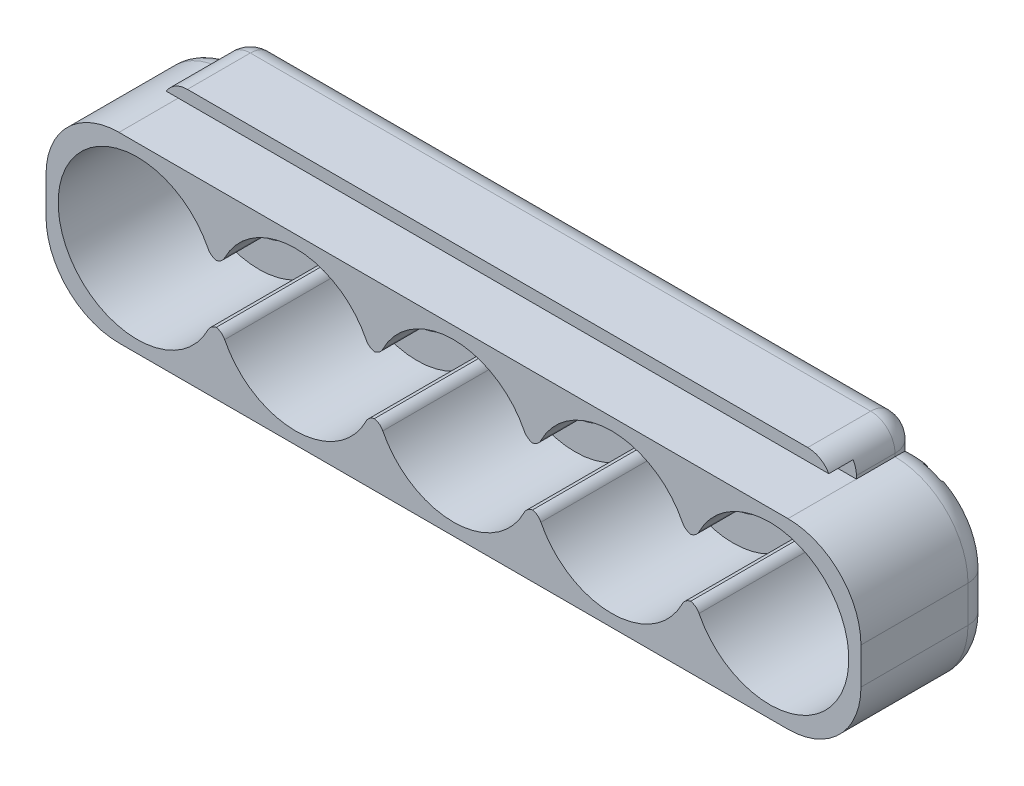
from build123d import *

# Parameters (mm, degrees)
BOSS_EXTRUDE1_DEPTH = 15
BOSS_EXTRUDE2_START = 0.8
SKETCH2_R           = 4
BOSS_EXTRUDE2_DEPTH = 0.8
FILLET1_R           = 1
BOSS_EXTRUDE5_DEPTH = 55
FILLET3_R           = 2
SKETCH5_W           = 52
SKETCH5_H           = 1
CUT_EXTRUDE1_DEPTH  = 0.8
CUT_EXTRUDE2_DEPTH  = 0.8
FILLET4_R           = 1


with BuildPart() as part:
    # Sketch1 → Boss-Extrude1 (new body)
    with BuildSketch(Plane.XY):
        with BuildLine():
            Line((-1.5, -7.5), (53.5, -7.5))
            ThreePointArc((53.5, -7.5), (57.742640687, -5.742640687), (59.5, -1.5))
            Line((59.5, -1.5), (59.5, 1.5))
            ThreePointArc((59.5, 1.5), (57.742640687, 5.742640687), (53.5, 7.5))
            Line((53.5, 7.5), (-1.5, 7.5))
            ThreePointArc((-1.5, 7.5), (-5.742640687, 5.742640687), (-7.5, 1.5))
            Line((-7.5, 1.5), (-7.5, -1.5))
            ThreePointArc((-7.5, -1.5), (-5.742640687, -5.742640687), (-1.5, -7.5))
        make_face()
        with BuildLine():
            Line((6.056434595, 2.36), (6.943565405, 2.36))
            ThreePointArc((6.943565405, 2.36), (13, 6.5), (19.056434595, 2.36))
            Line((19.056434595, 2.36), (19.943565405, 2.36))
            ThreePointArc((19.943565405, 2.36), (26, 6.5), (32.056434595, 2.36))
            Line((32.056434595, 2.36), (32.943565405, 2.36))
            ThreePointArc((32.943565405, 2.36), (39, 6.5), (45.056434595, 2.36))
            Line((45.056434595, 2.36), (45.943565405, 2.36))
            ThreePointArc((45.943565405, 2.36), (58.5, 0), (45.943565405, -2.36))
            Line((45.943565405, -2.36), (45.056434595, -2.36))
            ThreePointArc((45.056434595, -2.36), (39, -6.5), (32.943565405, -2.36))
            Line((32.943565405, -2.36), (32.056434595, -2.36))
            ThreePointArc((32.056434595, -2.36), (26, -6.5), (19.943565405, -2.36))
            Line((19.943565405, -2.36), (19.056434595, -2.36))
            ThreePointArc((19.056434595, -2.36), (13, -6.5), (6.943565405, -2.36))
            Line((6.943565405, -2.36), (6.056434595, -2.36))
            ThreePointArc((6.056434595, -2.36), (-6.5, 0), (6.056434595, 2.36))
        make_face(mode=Mode.SUBTRACT)
    extrude(amount=BOSS_EXTRUDE1_DEPTH)

    # Sketch2 → Boss-Extrude2 (add)
    with BuildSketch(Plane(origin=(0, 0, 0), x_dir=(-1, 0, 0), z_dir=(0, 0, -1)).offset(BOSS_EXTRUDE2_START)):
        with BuildLine():
            Line((-59.5, 1.5), (-59.5, -1.5))
            ThreePointArc((-59.5, -1.5), (-57.742640687, -5.742640687), (-53.5, -7.5))
            Line((-53.5, -7.5), (1.5, -7.5))
            ThreePointArc((1.5, -7.5), (5.742640687, -5.742640687), (7.5, -1.5))
            Line((7.5, -1.5), (7.5, 1.5))
            ThreePointArc((7.5, 1.5), (5.742640687, 5.742640687), (1.5, 7.5))
            Line((1.5, 7.5), (-53.5, 7.5))
            ThreePointArc((-53.5, 7.5), (-57.742640687, 5.742640687), (-59.5, 1.5))
        make_face()
        with Locations((-39, 0)):
            Circle(SKETCH2_R, mode=Mode.SUBTRACT)
        with Locations((-52, 0)):
            Circle(SKETCH2_R, mode=Mode.SUBTRACT)
        with Locations((-26, 0)):
            Circle(SKETCH2_R, mode=Mode.SUBTRACT)
        with Locations((-13, 0)):
            Circle(SKETCH2_R, mode=Mode.SUBTRACT)
        Circle(SKETCH2_R, mode=Mode.SUBTRACT)
    extrude(amount=-BOSS_EXTRUDE2_DEPTH)

    # Fillet1
    # the kernel refuses this fillet: 1 mm, written as the material it takes off along each edge
    with BuildSketch(Plane(origin=(19.056434595, 2.36, 0), x_dir=(-0.40597690727081176, 0.9138833354224305, 0), z_dir=(0, 0, 1)), Plane(origin=(32.056434595, 2.36, 0), x_dir=(-0.40597690727080554, 0.9138833354224334, 0), z_dir=(0, 0, 1)), Plane(origin=(32.943565405, -2.36, 0), x_dir=(0.4059769072708047, -0.9138833354224337, 0), z_dir=(0, 0, 1)), Plane(origin=(19.943565405, -2.36, 0), x_dir=(0.4059769072708137, -0.9138833354224297, 0), z_dir=(0, 0, 1)), Plane(origin=(6.943565405, -2.36, 0), x_dir=(0.40597690727080765, -0.9138833354224323, 0), z_dir=(0, 0, 1)), Plane(origin=(45.943565405, -2.36, 0), x_dir=(0.40597690727082786, -0.9138833354224234, 0), z_dir=(0, 0, 1)), Plane(origin=(45.056434595, 2.36, 0), x_dir=(-0.4059769072708126, 0.9138833354224302, 0), z_dir=(0, 0, 1))) as fillet1_piece_1:
        with BuildLine():
            CenterArc((0.650478585, -0.998920023), FILLET1_R, 92.663078582, 63.384561745)
            Line((-0.263404751, -0.592943116), (0, 0))
            ThreePointArc((0, 0), (0.302007914, -0.007019851), (0.604015829, 0))
        make_face()
    extrude(amount=16.622042696, mode=Mode.SUBTRACT)
    with BuildSketch(Plane(origin=(19.943565405, 2.36, 0), x_dir=(-1, 0, 0), z_dir=(0, 0, 1)), Plane(origin=(32.056434595, -2.36, 0), x_dir=(1, 0, 0), z_dir=(0, 0, 1)), Plane(origin=(19.056434595, -2.36, 0), x_dir=(1, 0, 0), z_dir=(0, 0, 1)), Plane(origin=(6.056434595, -2.36, 0), x_dir=(1, 0, 0), z_dir=(0, 0, 1)), Plane(origin=(6.943565405, 2.36, 0), x_dir=(-1, 0, 0), z_dir=(0, 0, 1)), Plane(origin=(45.056434595, -2.36, 0), x_dir=(1, 0, 0), z_dir=(0, 0, 1)), Plane(origin=(45.943565405, 2.36, 0), x_dir=(-1, 0, 0), z_dir=(0, 0, 1)), Plane(origin=(32.943565405, 2.36, 0), x_dir=(-1, 0, 0), z_dir=(0, 0, 1))) as fillet1_piece_2:
        with BuildLine():
            CenterArc((0.648817078, -1), FILLET1_R, 90, 63.384561745)
            ThreePointArc((-0.245216478, -0.552), (-0.116192914, -0.278849897), (0, 0))
            Line((0, 0), (0.648817078, 0))
        make_face()
    extrude(amount=16.622042696, mode=Mode.SUBTRACT)
    with BuildSketch(Plane(origin=(6.056434595, 2.36, 0), x_dir=(1, 0, 0), z_dir=(0, 0, 1))) as fillet1_piece_3:
        with BuildLine():
            CenterArc((0.648817078, 1), FILLET1_R, 206.615438255, 63.384561745)
            ThreePointArc((-0.245216478, 0.552), (-0.116192914, 0.278849897), (0, 0))
            Line((0, 0), (0.648817078, 0))
        make_face()
    extrude(amount=16.622042696, mode=Mode.SUBTRACT)

    # Sketch4 → Boss-Extrude5 (add)
    with BuildSketch(Plane(origin=(53.5, 0, 0), x_dir=(0, 0, -1), z_dir=(1, 0, 0))):
        with BuildLine():
            Line((-4.375, 8.75), (-4.375, 7.5))
            Line((-4.375, 7.5), (0.8, 7.5))
            Line((0.8, 7.5), (0.8, 7.75))
            ThreePointArc((0.8, 7.75), (0.214213562, 9.164213562), (-1.2, 9.75))
            Line((-1.2, 9.75), (-6.375, 9.75))
            Line((-6.375, 9.75), (-6.375, 8.75))
            Line((-6.375, 8.75), (-4.375, 8.75))
        make_face()
    extrude(amount=-BOSS_EXTRUDE5_DEPTH)

    # Fillet3
    fillet3_edges = [part.edges().sort_by_distance(p)[0] for p in [
        (-1.5, 7.625, -0.8),
        (-1.5, 9.164213562, -0.214213562),
        (53.5, 7.625, -0.8),
        (53.5, 9.164213562, -0.214213562),
        (-1.5, 9.75, 3.7875),
        (53.5, 9.75, 3.7875),
        (-5.742640687, 5.742640687, -0.8),
        (-7.5, 0, -0.8),
        (-5.742640687, -5.742640687, -0.8),
        (26, -7.5, -0.8),
        (57.742640687, -5.742640687, -0.8),
        (59.5, 0, -0.8),
        (57.742640687, 5.742640687, -0.8),
    ]]
    fillet(fillet3_edges, radius=FILLET3_R)

    # SurfaceCut1
    split(bisect_by=Plane.XY.offset(10), keep=Keep.BOTTOM)

    # Sketch5 → Cut-Extrude1 (cut)
    with BuildSketch(Plane(origin=(0, 0, -0.8), x_dir=(-1, 0, 0), z_dir=(0, 0, -1))):
        with Locations((-26, 0)):
            Rectangle(SKETCH5_W, SKETCH5_H)
    extrude(amount=-CUT_EXTRUDE1_DEPTH, mode=Mode.SUBTRACT)

    # Sketch6 → Cut-Extrude2 (cut)
    with BuildSketch(Plane(origin=(0, 0, -0.8), x_dir=(-1, 0, 0), z_dir=(0, 0, -1))):
        Polygon((-56.207106781, 6.906854249), (-54.792893219, 7.406854249), (-52.792893219, 1.75), (-54.207106781, 1.25), align=None)
        Polygon((2.792893219, 7.406854249), (0.792893219, 1.75), (2.207106781, 1.25), (4.207106781, 6.906854249), align=None)
    extrude(amount=-CUT_EXTRUDE2_DEPTH, mode=Mode.SUBTRACT)

    # Fillet4
    # the kernel refuses this fillet: 1 mm, written as the material it takes off along each edge
    with BuildSketch(Plane(origin=(48.031373033, -0.5, 2.002672601), x_dir=(0.21335743505986587, -0.9769742089250233, 0), z_dir=(0, 0, -1)), Plane(origin=(22.031373033, -0.5, 2.002672601), x_dir=(0.21335743505992955, -0.9769742089250094, 0), z_dir=(0, 0, -1)), Plane(origin=(9.031373033, -0.5, 2.002672601), x_dir=(0.2133574350599274, -0.97697420892501, 0), z_dir=(0, 0, -1)), Plane(origin=(35.031373033, -0.5, 2.002672601), x_dir=(0.21335743505992988, -0.9769742089250093, 0), z_dir=(0, 0, -1)), Plane(origin=(29.968626967, 0.5, 2.002672601), x_dir=(-0.21335743505992955, 0.9769742089250094, 0), z_dir=(0, 0, -1)), Plane(origin=(16.968626967, 0.5, 2.002672601), x_dir=(-0.21335743505992955, 0.9769742089250094, 0), z_dir=(0, 0, -1)), Plane(origin=(3.968626967, 0.5, 2.002672601), x_dir=(-0.21335743505992857, 0.9769742089250096, 0), z_dir=(0, 0, -1)), Plane(origin=(42.968626967, 0.5, 2.002672601), x_dir=(-0.21335743505992988, 0.9769742089250093, 0), z_dir=(0, 0, -1))) as fillet4_piece_1:
        with BuildLine():
            CenterArc((0.806060173, 0.995981227), FILLET4_R, 192.319179453, 72.542396876)
            Line((-0.170914036, 0.782623792), (0, 0))
            ThreePointArc((0, 0), (0.358248966, 0.016075091), (0.716497932, 0))
        make_face()
    extrude(amount=4.805345202, mode=Mode.SUBTRACT)
    with BuildSketch(Plane(origin=(29.968626967, -0.5, 2.002672601), x_dir=(1, 0, 0), z_dir=(0, 0, -1)), Plane(origin=(16.968626967, -0.5, 2.002672601), x_dir=(1, 0, 0), z_dir=(0, 0, -1)), Plane(origin=(3.968626967, -0.5, 2.002672601), x_dir=(1, 0, 0), z_dir=(0, 0, -1)), Plane(origin=(42.968626967, -0.5, 2.002672601), x_dir=(1, 0, 0), z_dir=(0, 0, -1)), Plane(origin=(48.031373033, 0.5, 2.002672601), x_dir=(-1, 0, 0), z_dir=(0, 0, -1)), Plane(origin=(22.031373033, 0.5, 2.002672601), x_dir=(-1, 0, 0), z_dir=(0, 0, -1)), Plane(origin=(9.031373033, 0.5, 2.002672601), x_dir=(-1, 0, 0), z_dir=(0, 0, -1)), Plane(origin=(35.031373033, 0.5, 2.002672601), x_dir=(-1, 0, 0), z_dir=(0, 0, -1))) as fillet4_piece_2:
        with BuildLine():
            CenterArc((0.80106904, 1), FILLET4_R, 197.457603124, 72.542396876)
            ThreePointArc((-0.152870161, 0.7), (-0.060730131, 0.35342974), (0, 0))
            Line((0, 0), (0.80106904, 0))
        make_face()
    extrude(amount=4.805345202, mode=Mode.SUBTRACT)
    with BuildSketch(Plane(origin=(-2.781489177, 2.874598748, 1.484276894), x_dir=(-0.6709066632823737, -0.741541805405003, 0), z_dir=(0, 0, -1))) as fillet4_piece_3:
        with BuildLine():
            CenterArc((0.597409926, 0.99779449), FILLET4_R, 208.391699237, 57.802272564)
            Line((-0.282307544, 0.522297726), (0, 0))
            ThreePointArc((0, 0), (0.265515523, 0.00882204), (0.531031045, 0))
        make_face()
    extrude(amount=3.768553788, mode=Mode.SUBTRACT)
    with BuildSketch(Plane(origin=(-1.487031304, 3.713318987, 2.332558478), x_dir=(-0.33333333333334225, 0.9428090415820602, 0), z_dir=(0, 0, -1))) as fillet4_piece_4:
        with BuildLine():
            CenterArc((0.933023391, 1), FILLET4_R, 189.622578682, 80.377421318)
            ThreePointArc((-0.052906851, 0.832842712), (-0.00467448, 0.417804877), (0, 0))
            Line((0, 0), (0.933023391, 0))
        make_face()
    extrude(amount=5.465116955, mode=Mode.SUBTRACT)
    with BuildSketch(Plane(origin=(0, 0, 0), x_dir=(-0.8323707778613388, 0.5542191697898132, 0), z_dir=(-0.5542191697898132, -0.8323707778613388, 0))) as fillet4_piece_5_section:
        with BuildLine():
            CenterArc((6.5 + FILLET4_R, -FILLET4_R), FILLET4_R, 90, 90)
            Line((6.5 + FILLET4_R, 0), (6.5, 0))
            Line((6.5, 0), (6.5, -FILLET4_R))
        make_face()
    fillet4_piece_5 = revolve(axis=Axis((0, 0, 0), (0, 0, -1)), revolution_arc=57.461210375, mode=Mode.PRIVATE)
    fillet4_piece_5 = split(fillet4_piece_5, bisect_by=Plane(origin=(-3.784303781, 5.710986776, 0.223439876), z_dir=(0.9428090415820611, 0.33333333333333975, 0)), keep=Keep.TOP, mode=Mode.PRIVATE)
    fillet4_piece_5 = split(fillet4_piece_5, bisect_by=Plane(origin=(-2.370090219, 6.210986776, 0.223439876), z_dir=(-0.9428090415820604, -0.33333333333334203, 0)), keep=Keep.TOP, mode=Mode.PRIVATE)
    add(fillet4_piece_5, mode=Mode.SUBTRACT)
    with BuildSketch(Plane(origin=(54.781489177, 2.874598748, 1.484276894), x_dir=(0.33333333333334436, 0.9428090415820595, 0), z_dir=(0, 0, -1))) as fillet4_piece_6:
        with BuildLine():
            CenterArc((0.593710758, 1), FILLET4_R, 212.197727436, 57.802272564)
            ThreePointArc((-0.252503544, 0.467157288), (-0.118490869, 0.237773495), (0, 0))
            Line((0, 0), (0.593710758, 0))
        make_face()
    extrude(amount=3.768553788, mode=Mode.SUBTRACT)
    with BuildSketch(Plane(origin=(53.487031304, 3.713318987, 2.332558478), x_dir=(0.3333333333333414, 0.9428090415820606, 0), z_dir=(0, 0, -1))) as fillet4_piece_7:
        with BuildLine():
            CenterArc((0.933023391, -1), FILLET4_R, 90, 80.377421318)
            ThreePointArc((-0.052906851, -0.832842712), (-0.00467448, -0.417804877), (0, 0))
            Line((0, 0), (0.933023391, 0))
        make_face()
    extrude(amount=5.465116955, mode=Mode.SUBTRACT)
    with BuildSketch(Plane(origin=(52, 0, 0), x_dir=(-0.019514340734898817, 0.999809577122405, 0), z_dir=(-0.999809577122405, -0.019514340734898817, 0))) as fillet4_piece_8_section:
        with BuildLine():
            CenterArc((6.5 + FILLET4_R, -FILLET4_R), FILLET4_R, 90, 90)
            Line((6.5 + FILLET4_R, 0), (6.5, 0))
            Line((6.5, 0), (6.5, -FILLET4_R))
        make_face()
    fillet4_piece_8 = revolve(axis=Axis((52, 0, 0), (0, 0, -1)), revolution_arc=57.461210375, mode=Mode.PRIVATE)
    fillet4_piece_8 = split(fillet4_piece_8, bisect_by=Plane(origin=(55.784303779, 5.710986769, 0.223439874), z_dir=(-0.9428090415820611, 0.3333333333333396, 0)), keep=Keep.TOP, mode=Mode.PRIVATE)
    fillet4_piece_8 = split(fillet4_piece_8, bisect_by=Plane(origin=(54.370090216, 6.210986769, 0.223439874), z_dir=(0.9428090415820604, -0.33333333333334186, 0)), keep=Keep.TOP, mode=Mode.PRIVATE)
    add(fillet4_piece_8, mode=Mode.SUBTRACT)


solid = part.part
